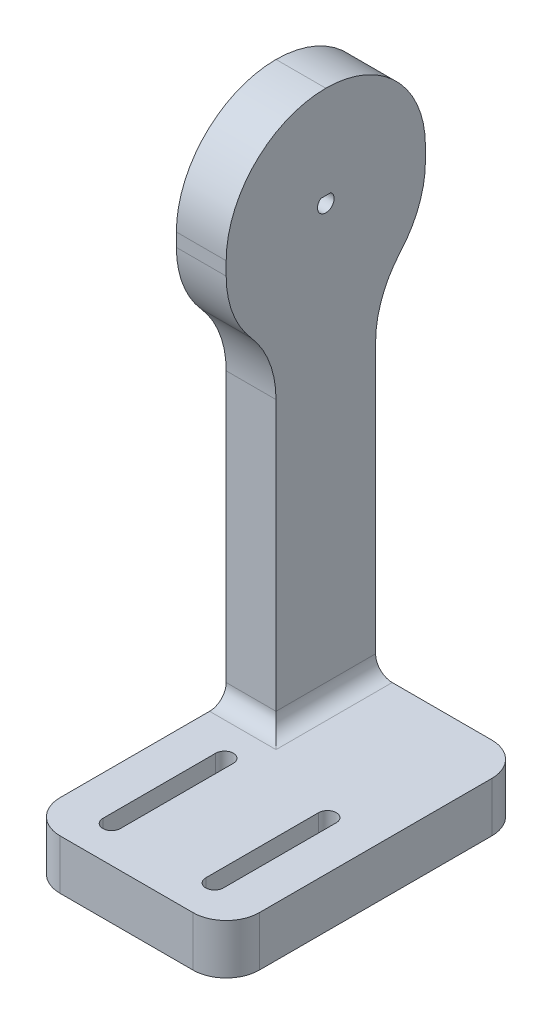
from build123d import *

# Parameters (mm, degrees)
SKETCH1_W           = 60
SKETCH1_H           = 60
BOSS_EXTRUDE1_DEPTH = 15
CUT_EXTRUDE1_DEPTH  = 15
SKETCH8_W           = 15
SKETCH8_H           = 30
BOSS_EXTRUDE2_DEPTH = 100
BOSS_EXTRUDE3_DEPTH = 15
CUT_EXTRUDE4_DEPTH  = 15
FILLET1_R           = 30
FILLET3_R           = 5
FILLET4_R           = 10
FILLET5_R           = 30


with BuildPart() as part:
    # Sketch1 → Boss-Extrude1 (new body)
    with BuildSketch(Plane(origin=(0, 0, 0), x_dir=(0, 0, -1), z_dir=(1, 0, 0))):
        Rectangle(SKETCH1_W, SKETCH1_H)
    extrude(amount=BOSS_EXTRUDE1_DEPTH)

    # Sketch2 → Cut-Extrude1 (cut)
    with BuildSketch(Plane(origin=(15, 0, 0), x_dir=(0, 0, -1), z_dir=(1, 0, 0))):
        with BuildLine():
            ThreePointArc((2.5, 0), (2.236067977, 1.118033989), (1.5, 2))
            Line((1.5, 2), (-1.5, 2))
            ThreePointArc((-1.5, 2), (-1.118033989, -2.236067977), (2.5, 0))
        make_face()
    extrude(amount=-CUT_EXTRUDE1_DEPTH, mode=Mode.SUBTRACT)

    # Sketch8 → Boss-Extrude2 (add)
    with BuildSketch(Plane.XZ.offset(30)):
        with Locations((7.5, 0)):
            Rectangle(SKETCH8_W, SKETCH8_H)
    extrude(amount=BOSS_EXTRUDE2_DEPTH)

    # Sketch9 → Boss-Extrude3 (add)
    with BuildSketch(Plane.XZ.offset(130)):
        Polygon((0, 0), (0, 75), (60, 75), (60, -15), (0, -15), align=None)
    extrude(amount=BOSS_EXTRUDE3_DEPTH)

    # Sketch10 → Cut-Extrude4 (cut)
    with BuildSketch(Plane(origin=(0, -130, 0), x_dir=(1, 0, 0), z_dir=(0, 1, 0))):
        with BuildLine():
            Line((48.15, -64), (48.15, -30))
            ThreePointArc((48.15, -30), (45.5, -27.35), (42.85, -30))
            Line((42.85, -30), (42.85, -64))
            ThreePointArc((42.85, -64), (45.5, -66.65), (48.15, -64))
        make_face()
        with BuildLine():
            Line((17.15, -64), (17.15, -30))
            ThreePointArc((17.15, -30), (14.5, -27.35), (11.85, -30))
            Line((11.85, -30), (11.85, -64))
            ThreePointArc((11.85, -64), (14.5, -66.65), (17.15, -64))
        make_face()
    extrude(amount=-CUT_EXTRUDE4_DEPTH, mode=Mode.SUBTRACT)

    # Fillet1
    # the kernel refuses this fillet: 30 mm, written as the material it takes off along each edge
    with BuildSketch(Plane(origin=(-75, 30, 30), x_dir=(0, -1, 0), z_dir=(1, 0, 0))) as fillet1_piece_1:
        with BuildLine():
            CenterArc((FILLET1_R, FILLET1_R), FILLET1_R, 180, 90)
            Line((0, FILLET1_R), (-FILLET1_R * 0.02, FILLET1_R))
            Line((-FILLET1_R * 0.02, FILLET1_R), (-FILLET1_R * 0.02, -FILLET1_R * 0.02))
            Line((-FILLET1_R * 0.02, -FILLET1_R * 0.02), (FILLET1_R, -FILLET1_R * 0.02))
            Line((FILLET1_R, -FILLET1_R * 0.02), (FILLET1_R, 0))
        make_face()
    extrude(amount=165, mode=Mode.SUBTRACT)
    with BuildSketch(Plane(origin=(-64.951905284, -30, 30), x_dir=(0, 0, -1), z_dir=(1, 0, 0))) as fillet1_piece_2:
        with BuildLine():
            CenterArc((30, 25.980762114), FILLET1_R, 180, 60)
            Line((0, 25.980762114), (-0.6, 25.980762114))
            Line((-0.6, 25.980762114), (-0.6, 0))
            Line((-0.6, 0), (0, -0.6))
            ThreePointArc((0, -0.6), (7.5, -0.6), (14.7, -0.519615242))
            Line((14.7, -0.519615242), (15, 0))
        make_face()
    extrude(amount=144.903810568, mode=Mode.SUBTRACT)
    with BuildSketch(Plane(origin=(-64.951905284, -30, -30), x_dir=(0, 0, 1), z_dir=(1, 0, 0))) as fillet1_piece_3:
        with BuildLine():
            CenterArc((30, -25.980762114), FILLET1_R, 120, 60)
            Line((0, -25.980762114), (-0.6, -25.980762114))
            Line((-0.6, -25.980762114), (-0.6, 0))
            Line((-0.6, 0), (0, 0.6))
            ThreePointArc((0, 0.6), (7.5, 0.6), (14.7, 0.519615242))
            Line((14.7, 0.519615242), (15, 0))
        make_face()
    extrude(amount=144.903810568, mode=Mode.SUBTRACT)
    with BuildSketch(Plane(origin=(-75, 30, -30), x_dir=(0, -1, 0), z_dir=(1, 0, 0))) as fillet1_piece_4:
        with BuildLine():
            CenterArc((FILLET1_R, -FILLET1_R), FILLET1_R, 90, 90)
            Line((0, -FILLET1_R), (-FILLET1_R * 0.02, -FILLET1_R))
            Line((-FILLET1_R * 0.02, -FILLET1_R), (-FILLET1_R * 0.02, FILLET1_R * 0.02))
            Line((-FILLET1_R * 0.02, FILLET1_R * 0.02), (FILLET1_R, FILLET1_R * 0.02))
            Line((FILLET1_R, FILLET1_R * 0.02), (FILLET1_R, 0))
        make_face()
    extrude(amount=165, mode=Mode.SUBTRACT)

    # Fillet3
    fillet3_edges = [part.edges().sort_by_distance(p)[0] for p in [
        (15, -130, 0),
        (7.5, -130, 15),
    ]]
    fillet(fillet3_edges, radius=FILLET3_R)

    # Fillet4
    fillet4_edges = [part.edges().sort_by_distance(p)[0] for p in [
        (60, -137.5, -15),
        (60, -137.5, 75),
        (0, -137.5, 75),
    ]]
    fillet(fillet4_edges, radius=FILLET4_R)

    # Fillet5
    fillet5_edges = [part.edges().sort_by_distance(p)[0] for p in [
        (7.5, -30, -15),
        (7.5, -30, 15),
    ]]
    fillet(fillet5_edges, radius=FILLET5_R)


solid = part.part
